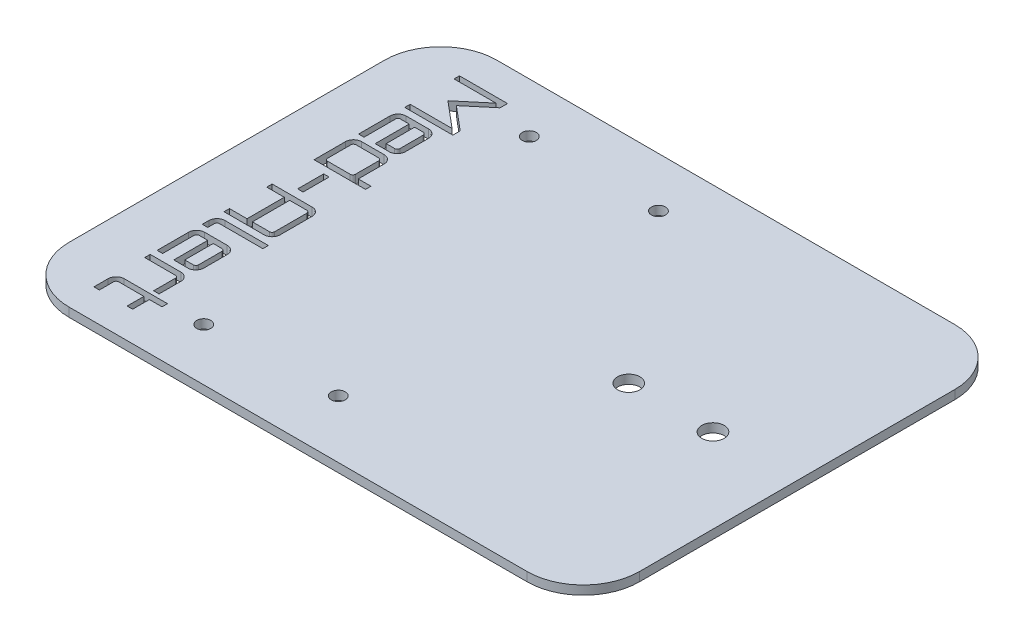
from build123d import *

# Parameters (mm, degrees)
SKETCH1_W           = 101.6
SKETCH1_H           = 76.2
BOSS_EXTRUDE1_DEPTH = 1.5875
SKETCH2_R           = 2
CUT_EXTRUDE1_DEPTH  = 64.51984065
FILLET1_R           = 10
SKETCH4_R           = 1.25
CUT_EXTRUDE2_DEPTH  = 64.51984065
SKETCH5_W           = 0.973447217
SKETCH5_H           = 4.636773317
CUT_EXTRUDE3_DEPTH  = 1.5875


with BuildPart() as part:
    # Sketch1 → Boss-Extrude1 (new body)
    with BuildSketch(Plane(origin=(0, 0, 0), x_dir=(1, 0, 0), z_dir=(0, 1, 0))):
        Rectangle(SKETCH1_W, SKETCH1_H)
    extrude(amount=BOSS_EXTRUDE1_DEPTH)

    # Sketch2 → Cut-Extrude1 (cut, through all)
    with BuildSketch(Plane(origin=(0, 1.5875, 0), x_dir=(1, 0, 0), z_dir=(0, 1, 0))):
        with Locations((35.8, 0)):
            Circle(SKETCH2_R)
        with Locations((20.8, 0)):
            Circle(SKETCH2_R)
    extrude(amount=-CUT_EXTRUDE1_DEPTH, mode=Mode.SUBTRACT)

    # Fillet1
    fillet1_edges = [part.edges().sort_by_distance(p)[0] for p in [
        (-50.8, 0.79375, -38.1),
        (-50.8, 0.79375, 38.1),
        (50.8, 0.79375, 38.1),
        (50.8, 0.79375, -38.1),
    ]]
    fillet(fillet1_edges, radius=FILLET1_R)

    # Sketch4 → Cut-Extrude2 (cut, through all)
    with BuildSketch(Plane(origin=(0, 1.5875, 0), x_dir=(1, 0, 0), z_dir=(0, 1, 0))):
        with Locations((-3.134370543, 29.218470634)):
            Circle(SKETCH4_R)
        with Locations((-3.134370543, -27.818050268)):
            Circle(SKETCH4_R)
        with Locations((-26.134370543, 29.218470634)):
            Circle(SKETCH4_R)
        with Locations((-26.134370543, -28.781529366)):
            Circle(SKETCH4_R)
    extrude(amount=-CUT_EXTRUDE2_DEPTH, mode=Mode.SUBTRACT)

    # Sketch5 → Cut-Extrude3 (cut)
    # profile 1 of 9: a face of its own
    with BuildSketch(Plane(origin=(0, 1.5875, 0), x_dir=(1, 0, 0), z_dir=(0, 1, 0))):
        Polygon((-41.714230592, 32.355940808), (-33.154430592, 32.355940808), (-33.154430592, 31.036799437), (-37.387034128, 27.481825236), (-33.154430592, 23.926851035), (-33.154430592, 22.607709664), (-41.714230592, 22.607709664), (-41.714230592, 23.570837653), (-34.248268808, 23.570837653), (-38.897081225, 27.481825236), (-34.248268808, 31.392812819), (-41.714230592, 31.392812819), align=None)
    # profile 2 of 9: a face of its own
    with BuildSketch(Plane(origin=(0, 1.5875, 0), x_dir=(1, 0, 0), z_dir=(0, 1, 0))):
        with BuildLine():
            add(Edge.make_bspline(
                [(-41.714230592, 19.969426924), (-41.712202655, 20.03385511), (-41.708200637, 20.161000417), (-41.667763496, 20.34624286), (-41.608496053, 20.524098308), (-41.52139129, 20.690482564), (-41.414767915, 20.844435426), (-41.292564206, 20.985579979), (-41.151417443, 21.107739613), (-40.997518132, 21.214543913), (-40.830272787, 21.30130826), (-40.653091122, 21.362959028), (-40.467195446, 21.40071205), (-40.340805862, 21.405036419), (-40.276418095, 21.407239421)],
                knots=[0, 0, 0, 0, 1.027217016, 2.02715352, 3.014270877, 4.013201324, 5.0135986, 5.999569355, 6.985540111, 7.985937386, 8.984867834, 9.983630507, 10.972782984, 12, 12, 12, 12], degree=3))
            Line((-40.276418095, 21.407239421), (-36.257078613, 21.407239421))
            add(Edge.make_bspline(
                [(-36.257078613, 21.407239421), (-36.192706319, 21.404969561), (-36.065784313, 21.400494108), (-35.879657952, 21.363562077), (-35.702807278, 21.300859029), (-35.535960075, 21.214597926), (-35.382087657, 21.107724252), (-35.240917391, 20.985588146), (-35.118781285, 20.844417879), (-35.011907611, 20.690545462), (-34.925646508, 20.523698259), (-34.86294346, 20.346847585), (-34.826011429, 20.160721224), (-34.821535976, 20.033799218), (-34.819266116, 19.969426924)],
                knots=[0, 0, 0, 0, 1.027084364, 2.025088736, 3.015087032, 4.013888481, 5.014156569, 6, 6.985843431, 7.986111519, 8.984912968, 9.974911264, 10.972915636, 12, 12, 12, 12], degree=3))
            Line((-34.819266116, 19.969426924), (-34.819266116, 15.833136186))
            add(Edge.make_bspline(
                [(-34.819266116, 15.833136186), (-34.821521309, 15.767049633), (-34.82594932, 15.637290448), (-34.862649634, 15.447656636), (-34.925705942, 15.268625343), (-35.011438059, 15.100319889), (-35.118745743, 14.946031506), (-35.241478514, 14.805018411), (-35.381455096, 14.680898566), (-35.536104242, 14.57449672), (-35.702385771, 14.487274781), (-35.880268447, 14.428038396), (-36.065503623, 14.387592965), (-36.192649924, 14.383592081), (-36.257078613, 14.381564718)],
                knots=[0, 0, 0, 0, 1.048634584, 2.058966034, 3.052054572, 4.053408781, 5.048122636, 6.02849193, 7.014884473, 8.009598329, 9.002853689, 9.984363071, 10.978618772, 12, 12, 12, 12], degree=3))
            Line((-36.257078613, 14.381564718), (-38.754331898, 14.381564718))
            Line((-38.754331898, 14.381564718), (-38.754331898, 20.433792204))
            Line((-38.754331898, 20.433792204), (-40.276418095, 20.433792204))
            add(Edge.make_bspline(
                [(-40.276418095, 20.433792204), (-40.307010937, 20.432251722), (-40.367052556, 20.429228365), (-40.453565175, 20.40168996), (-40.533952598, 20.358351206), (-40.604277118, 20.298022348), (-40.666133623, 20.228932046), (-40.706521439, 20.147749524), (-40.734815441, 20.061305712), (-40.737621004, 20.000625891), (-40.739063504, 19.969426924)],
                knots=[0, 0, 0, 0, 1.007354179, 1.977036842, 2.967724579, 4.002259672, 5.022329906, 6.004122603, 6.973805265, 8, 8, 8, 8], degree=3))
            Line((-40.739063504, 19.969426924), (-40.739063504, 14.381564718))
            Line((-40.739063504, 14.381564718), (-41.714230592, 14.381564718))
            Line((-41.714230592, 14.381564718), (-41.714230592, 19.969426924))
        make_face()
        with BuildLine():
            Line((-37.77916481, 20.433792204), (-37.77916481, 15.368770906))
            Line((-37.77916481, 15.368770906), (-36.257078613, 15.368770906))
            add(Edge.make_bspline(
                [(-36.257078613, 15.368770906), (-36.226460685, 15.370265567), (-36.166369832, 15.373198995), (-36.080476665, 15.4013127), (-35.999293132, 15.441700873), (-35.930203168, 15.503557226), (-35.86987401, 15.573881985), (-35.826536074, 15.654268642), (-35.798819889, 15.741333289), (-35.795922776, 15.80196299), (-35.794433204, 15.833136186)],
                knots=[0, 0, 0, 0, 1.007354179, 1.977036842, 2.958829539, 3.978899773, 5.013434866, 6.004122603, 6.973805265, 8, 8, 8, 8], degree=3))
            Line((-35.794433204, 15.833136186), (-35.794433204, 19.969426924))
            add(Edge.make_bspline(
                [(-35.794433204, 19.969426924), (-35.795915847, 20.000605439), (-35.798799485, 20.061245484), (-35.826613164, 20.148235294), (-35.869364321, 20.228523442), (-35.93074951, 20.297475989), (-35.999701779, 20.358860916), (-36.079990749, 20.401612818), (-36.166428813, 20.429248347), (-36.226480594, 20.432258466), (-36.257078613, 20.433792204)],
                knots=[0, 0, 0, 0, 1.026909697, 1.99726795, 2.988645912, 4.009426841, 5.03020777, 6.021585732, 6.991943984, 8, 8, 8, 8], degree=3))
            Line((-36.257078613, 20.433792204), (-37.77916481, 20.433792204))
        make_face(mode=Mode.SUBTRACT)
    # profile 3 of 9: a face of its own
    with BuildSketch(Plane(origin=(0, 1.5875, 0), x_dir=(1, 0, 0), z_dir=(0, 1, 0))):
        with BuildLine():
            add(Edge.make_bspline(
                [(-41.714230592, 12.035660117), (-41.712221556, 12.101802574), (-41.708273492, 12.231782622), (-41.668055971, 12.420543059), (-41.608429869, 12.60055972), (-41.521887325, 12.768442755), (-41.414713989, 12.92267934), (-41.29257856, 13.063859825), (-41.151413534, 13.186009848), (-40.997519184, 13.292816759), (-40.830272505, 13.379580404), (-40.653091196, 13.44123136), (-40.467195426, 13.478984332), (-40.340805856, 13.483308708), (-40.276418095, 13.485511714)],
                knots=[0, 0, 0, 0, 1.049191641, 2.061822075, 3.052470829, 4.054356978, 5.049599247, 6.030489334, 7.011379422, 8.00662169, 9.000404689, 9.994020778, 10.978076193, 12, 12, 12, 12], degree=3))
            Line((-40.276418095, 13.485511714), (-36.257078613, 13.485511714))
            add(Edge.make_bspline(
                [(-36.257078613, 13.485511714), (-36.192706325, 13.48324185), (-36.065784332, 13.47876639), (-35.879657879, 13.441834408), (-35.702807552, 13.379131177), (-35.535959038, 13.292870764), (-35.382091508, 13.185994517), (-35.240903252, 13.063867881), (-35.118834402, 12.922662211), (-35.011413975, 12.768504282), (-34.925712347, 12.600163549), (-34.862647901, 12.421141672), (-34.825949776, 12.231505328), (-34.821521462, 12.101746492), (-34.819266116, 12.035660117)],
                knots=[0, 0, 0, 0, 1.021792034, 2.014653917, 2.999550978, 3.993205832, 4.988319767, 5.969083372, 6.949846977, 7.944960913, 8.946717872, 9.940205837, 10.950943649, 12, 12, 12, 12], degree=3))
            Line((-34.819266116, 12.035660117), (-34.819266116, 7.435004099))
            Line((-34.819266116, 7.435004099), (-32.561074956, 7.435004099))
            Line((-32.561074956, 7.435004099), (-32.561074956, 6.45983701))
            Line((-32.561074956, 6.45983701), (-41.714230592, 6.45983701))
            Line((-41.714230592, 6.45983701), (-41.714230592, 12.035660117))
        make_face()
        with BuildLine():
            Line((-40.739063504, 12.035660117), (-40.739063504, 7.897649508))
            add(Edge.make_bspline(
                [(-40.739063504, 7.897649508), (-40.737562032, 7.86703679), (-40.73461524, 7.806956163), (-40.706599302, 7.720988192), (-40.665634815, 7.639699996), (-40.604831642, 7.569235961), (-40.534367606, 7.508432787), (-40.45307941, 7.4674683), (-40.36711144, 7.439452363), (-40.307030812, 7.43650557), (-40.276418095, 7.435004099)],
                knots=[0, 0, 0, 0, 1.009027997, 1.980321883, 2.963745925, 4, 5.036254075, 6.019678117, 6.990972003, 8, 8, 8, 8], degree=3))
            Line((-40.276418095, 7.435004099), (-36.257078613, 7.435004099))
            add(Edge.make_bspline(
                [(-36.257078613, 7.435004099), (-36.226460685, 7.43649876), (-36.166369833, 7.439432187), (-36.080476661, 7.467545896), (-35.999293144, 7.507934054), (-35.930203121, 7.569790463), (-35.869874187, 7.64011501), (-35.826535452, 7.720502426), (-35.798997042, 7.807015047), (-35.795973686, 7.867056666), (-35.794433204, 7.897649508)],
                knots=[0, 0, 0, 0, 1.009732169, 1.981703892, 2.965814237, 3.988292478, 5.025269725, 6.018296108, 6.990267831, 8, 8, 8, 8], degree=3))
            Line((-35.794433204, 7.897649508), (-35.794433204, 12.035660117))
            add(Edge.make_bspline(
                [(-35.794433204, 12.035660117), (-35.795966942, 12.066258136), (-35.79897706, 12.126309916), (-35.826612593, 12.212747984), (-35.86936448, 12.293036939), (-35.930749467, 12.361989262), (-35.99970179, 12.423374249), (-36.079990746, 12.466126136), (-36.166428814, 12.493761669), (-36.226480594, 12.496771788), (-36.257078613, 12.498305525)],
                knots=[0, 0, 0, 0, 1.010437324, 1.983087831, 2.976807703, 4, 5.023192297, 6.016912169, 6.989562676, 8, 8, 8, 8], degree=3))
            Line((-36.257078613, 12.498305525), (-40.276418095, 12.498305525))
            add(Edge.make_bspline(
                [(-40.276418095, 12.498305525), (-40.307010937, 12.496765043), (-40.367052555, 12.493741687), (-40.453565176, 12.466203277), (-40.533952592, 12.422864543), (-40.604277139, 12.362535609), (-40.666133548, 12.293445586), (-40.706521706, 12.212262068), (-40.734635416, 12.126368897), (-40.737568843, 12.066278044), (-40.739063504, 12.035660117)],
                knots=[0, 0, 0, 0, 1.009732169, 1.981703892, 2.974730275, 4.011707522, 5.034185763, 6.018296108, 6.990267831, 8, 8, 8, 8], degree=3))
        make_face(mode=Mode.SUBTRACT)
    # profile 4 of 9: a face of its own
    with BuildSketch(Plane(origin=(0, 1.5875, 0), x_dir=(1, 0, 0), z_dir=(0, 1, 0))):
        with Locations((-38.195373691, 2.813709624)):
            Rectangle(SKETCH5_W, SKETCH5_H)
    # profile 5 of 9: a face of its own
    with BuildSketch(Plane(origin=(0, 1.5875, 0), x_dir=(1, 0, 0), z_dir=(0, 1, 0))):
        with BuildLine():
            Line((-41.714230592, -1.019883745), (-34.581923861, -1.019883745))
            add(Edge.make_bspline(
                [(-34.581923861, -1.019883745), (-34.51752073, -1.022062661), (-34.390537922, -1.026358801), (-34.205222364, -1.064527671), (-34.02728682, -1.12204368), (-33.861510954, -1.207773361), (-33.706472823, -1.310520478), (-33.56610203, -1.430903159), (-33.44456763, -1.570361941), (-33.34239086, -1.725299973), (-33.2565718, -1.891005328), (-33.199079563, -2.068959626), (-33.160904336, -2.254270169), (-33.156609066, -2.381253663), (-33.154430592, -2.445657143)],
                knots=[0, 0, 0, 0, 1.032216714, 2.035208122, 3.024182869, 4.023794347, 5.018739673, 6.003470517, 6.981260327, 7.976205653, 8.975817131, 9.964791878, 10.967783286, 12, 12, 12, 12], degree=3))
            Line((-33.154430592, -2.445657143), (-33.154430592, -8.152190476))
            add(Edge.make_bspline(
                [(-33.154430592, -8.152190476), (-33.156542973, -8.216608949), (-33.160689459, -8.343058806), (-33.199666595, -8.52815158), (-33.256124602, -8.706422535), (-33.342465046, -8.872505218), (-33.44446762, -9.027589131), (-33.566673078, -9.166862181), (-33.705852561, -9.289188419), (-33.861593547, -9.391699752), (-34.027264928, -9.477548826), (-34.205228262, -9.53503308), (-34.390536388, -9.573210442), (-34.517520214, -9.577505419), (-34.581923861, -9.579683745)],
                knots=[0, 0, 0, 0, 1.03172279, 2.025214077, 3.022441902, 4.021575058, 5.016044295, 5.993366225, 6.983661833, 7.97813107, 8.977264226, 9.965765741, 10.96827721, 12, 12, 12, 12], degree=3))
            Line((-34.581923861, -9.579683745), (-41.714230592, -9.579683745))
            Line((-41.714230592, -9.579683745), (-41.714230592, -8.616555756))
            Line((-41.714230592, -8.616555756), (-38.587504372, -8.616555756))
            Line((-38.587504372, -8.616555756), (-38.587504372, -1.983011734))
            Line((-38.587504372, -1.983011734), (-41.714230592, -1.983011734))
            Line((-41.714230592, -1.983011734), (-41.714230592, -1.019883745))
        make_face()
        with BuildLine():
            Line((-37.624376383, -1.983011734), (-37.624376383, -8.616555756))
            Line((-37.624376383, -8.616555756), (-34.581923861, -8.616555756))
            add(Edge.make_bspline(
                [(-34.581923861, -8.616555756), (-34.550724894, -8.615113256), (-34.490045072, -8.612307693), (-34.403601265, -8.584013695), (-34.322418726, -8.543625865), (-34.253328485, -8.481769416), (-34.192999403, -8.411444683), (-34.149661447, -8.331058019), (-34.121945267, -8.243993374), (-34.119048153, -8.183363673), (-34.117558581, -8.152190476)],
                knots=[0, 0, 0, 0, 1.023783653, 1.991188011, 2.970673951, 3.988347493, 5.020451908, 6.008811989, 6.976216347, 8, 8, 8, 8], degree=3))
            Line((-34.117558581, -8.152190476), (-34.117558581, -2.445657143))
            add(Edge.make_bspline(
                [(-34.117558581, -2.445657143), (-34.119092319, -2.415059123), (-34.122102438, -2.355007343), (-34.149737967, -2.268569279), (-34.19248987, -2.188280309), (-34.253874796, -2.11932804), (-34.322827343, -2.057942851), (-34.403115491, -2.015191693), (-34.490105301, -1.987378014), (-34.550745346, -1.984494377), (-34.581923861, -1.983011734)],
                knots=[0, 0, 0, 0, 1.008056016, 1.978414268, 2.96979223, 3.990573159, 5.011354088, 6.00273205, 6.973090303, 8, 8, 8, 8], degree=3))
            Line((-34.581923861, -1.983011734), (-37.624376383, -1.983011734))
        make_face(mode=Mode.SUBTRACT)
    # profile 6 of 9: a face of its own
    with BuildSketch(Plane(origin=(0, 1.5875, 0), x_dir=(1, 0, 0), z_dir=(0, 1, 0))):
        with BuildLine():
            add(Edge.make_bspline(
                [(-41.714230592, -12.293640828), (-41.712202655, -12.229212641), (-41.708200638, -12.10206733), (-41.667763493, -11.916824907), (-41.608496065, -11.738969385), (-41.521391245, -11.572585411), (-41.414768084, -11.418631496), (-41.292563588, -11.277490819), (-41.151419768, -11.155316695), (-40.997509321, -11.048567217), (-40.830305598, -10.961597953), (-40.652861155, -10.900671947), (-40.467427317, -10.860060752), (-40.340845602, -10.856116171), (-40.276418095, -10.854108459)],
                knots=[0, 0, 0, 0, 1.02706128, 2.026846186, 3.013813887, 4.012592888, 5.012838495, 5.998659769, 6.984481042, 7.984726649, 8.98350565, 9.982116902, 10.97293872, 12, 12, 12, 12], degree=3))
            Line((-40.276418095, -10.854108459), (-32.561074956, -10.854108459))
            Line((-32.561074956, -10.854108459), (-32.561074956, -11.829275548))
            Line((-32.561074956, -11.829275548), (-40.276418095, -11.829275548))
            add(Edge.make_bspline(
                [(-40.276418095, -11.829275548), (-40.307010937, -11.83081603), (-40.367052556, -11.833839387), (-40.453565175, -11.861377792), (-40.533952598, -11.904716546), (-40.604277118, -11.965045404), (-40.666133623, -12.034135705), (-40.706521439, -12.115318228), (-40.734815441, -12.20176204), (-40.737621004, -12.262441861), (-40.739063504, -12.293640828)],
                knots=[0, 0, 0, 0, 1.007354179, 1.977036842, 2.967724579, 4.002259672, 5.022329906, 6.004122603, 6.973805265, 8, 8, 8, 8], degree=3))
            Line((-40.739063504, -12.293640828), (-40.739063504, -13.457993771))
            Line((-40.739063504, -13.457993771), (-41.714230592, -13.457993771))
            Line((-41.714230592, -13.457993771), (-41.714230592, -12.293640828))
        make_face()
    # profile 7 of 9: a face of its own
    with BuildSketch(Plane(origin=(0, 1.5875, 0), x_dir=(1, 0, 0), z_dir=(0, 1, 0))):
        with BuildLine():
            add(Edge.make_bspline(
                [(-41.714230592, -15.913970143), (-41.712202655, -15.849541957), (-41.708200637, -15.722396649), (-41.667763496, -15.537154206), (-41.608496053, -15.359298759), (-41.52139129, -15.192914503), (-41.414767915, -15.03896164), (-41.292564206, -14.897817087), (-41.151417443, -14.775657454), (-40.997518132, -14.668853153), (-40.830272787, -14.582088807), (-40.653091122, -14.520438038), (-40.467195446, -14.482685017), (-40.340805862, -14.478360647), (-40.276418095, -14.476157645)],
                knots=[0, 0, 0, 0, 1.027217016, 2.02715352, 3.014270877, 4.013201324, 5.0135986, 5.999569355, 6.985540111, 7.985937386, 8.984867834, 9.983630507, 10.972782984, 12, 12, 12, 12], degree=3))
            Line((-40.276418095, -14.476157645), (-36.257078613, -14.476157645))
            add(Edge.make_bspline(
                [(-36.257078613, -14.476157645), (-36.192706319, -14.478427505), (-36.065784313, -14.482902959), (-35.879657952, -14.519834989), (-35.702807278, -14.582538038), (-35.535960075, -14.668799141), (-35.382087657, -14.775672815), (-35.240917391, -14.89780892), (-35.118781285, -15.038979187), (-35.011907611, -15.192851605), (-34.925646508, -15.359698807), (-34.86294346, -15.536549482), (-34.826011429, -15.722675842), (-34.821535976, -15.849597848), (-34.819266116, -15.913970143)],
                knots=[0, 0, 0, 0, 1.027084364, 2.025088736, 3.015087032, 4.013888481, 5.014156569, 6, 6.985843431, 7.986111519, 8.984912968, 9.974911264, 10.972915636, 12, 12, 12, 12], degree=3))
            Line((-34.819266116, -15.913970143), (-34.819266116, -20.05026088))
            add(Edge.make_bspline(
                [(-34.819266116, -20.05026088), (-34.821521309, -20.116347434), (-34.82594932, -20.246106619), (-34.862649634, -20.43574043), (-34.925705942, -20.614771724), (-35.011438059, -20.783077178), (-35.118745743, -20.937365561), (-35.241478514, -21.078378656), (-35.381455096, -21.202498501), (-35.536104242, -21.308900347), (-35.702385771, -21.396122286), (-35.880268447, -21.45535867), (-36.065503623, -21.495804101), (-36.192649924, -21.499804986), (-36.257078613, -21.501832349)],
                knots=[0, 0, 0, 0, 1.048634584, 2.058966034, 3.052054572, 4.053408781, 5.048122636, 6.02849193, 7.014884473, 8.009598329, 9.002853689, 9.984363071, 10.978618772, 12, 12, 12, 12], degree=3))
            Line((-36.257078613, -21.501832349), (-38.754331898, -21.501832349))
            Line((-38.754331898, -21.501832349), (-38.754331898, -15.449604862))
            Line((-38.754331898, -15.449604862), (-40.276418095, -15.449604862))
            add(Edge.make_bspline(
                [(-40.276418095, -15.449604862), (-40.307010937, -15.451145345), (-40.367052556, -15.454168702), (-40.453565175, -15.481707107), (-40.533952598, -15.525045861), (-40.604277118, -15.585374719), (-40.666133623, -15.65446502), (-40.706521439, -15.735647543), (-40.734815441, -15.822091355), (-40.737621004, -15.882771176), (-40.739063504, -15.913970143)],
                knots=[0, 0, 0, 0, 1.007354179, 1.977036842, 2.967724579, 4.002259672, 5.022329906, 6.004122603, 6.973805265, 8, 8, 8, 8], degree=3))
            Line((-40.739063504, -15.913970143), (-40.739063504, -21.501832349))
            Line((-40.739063504, -21.501832349), (-41.714230592, -21.501832349))
            Line((-41.714230592, -21.501832349), (-41.714230592, -15.913970143))
        make_face()
        with BuildLine():
            Line((-37.77916481, -15.449604862), (-37.77916481, -20.51462616))
            Line((-37.77916481, -20.51462616), (-36.257078613, -20.51462616))
            add(Edge.make_bspline(
                [(-36.257078613, -20.51462616), (-36.226460685, -20.513131499), (-36.166369832, -20.510198072), (-36.080476665, -20.482084366), (-35.999293132, -20.441696194), (-35.930203168, -20.379839841), (-35.86987401, -20.309515081), (-35.826536074, -20.229128424), (-35.798819889, -20.142063777), (-35.795922776, -20.081434077), (-35.794433204, -20.05026088)],
                knots=[0, 0, 0, 0, 1.007354179, 1.977036842, 2.958829539, 3.978899773, 5.013434866, 6.004122603, 6.973805265, 8, 8, 8, 8], degree=3))
            Line((-35.794433204, -20.05026088), (-35.794433204, -15.913970143))
            add(Edge.make_bspline(
                [(-35.794433204, -15.913970143), (-35.795915847, -15.882791627), (-35.798799485, -15.822151583), (-35.826613164, -15.735161773), (-35.869364321, -15.654873625), (-35.93074951, -15.585921077), (-35.999701779, -15.524536151), (-36.079990749, -15.481784248), (-36.166428813, -15.454148719), (-36.226480594, -15.4511386), (-36.257078613, -15.449604862)],
                knots=[0, 0, 0, 0, 1.026909697, 1.99726795, 2.988645912, 4.009426841, 5.03020777, 6.021585732, 6.991943984, 8, 8, 8, 8], degree=3))
            Line((-36.257078613, -15.449604862), (-37.77916481, -15.449604862))
        make_face(mode=Mode.SUBTRACT)
    # profile 8 of 9: a face of its own
    with BuildSketch(Plane(origin=(0, 1.5875, 0), x_dir=(1, 0, 0), z_dir=(0, 1, 0))):
        with BuildLine():
            Line((-41.714230592, -22.741859634), (-36.257078613, -22.741859634))
            add(Edge.make_bspline(
                [(-36.257078613, -22.741859634), (-36.192667344, -22.743936139), (-36.06555542, -22.748034001), (-35.879883583, -22.787809583), (-35.702775245, -22.849800753), (-35.535968708, -22.936263894), (-35.38208538, -23.04308336), (-35.240917997, -23.165233793), (-35.11878112, -23.306400227), (-35.011907656, -23.460273686), (-34.925646497, -23.627120609), (-34.862943463, -23.803971358), (-34.826011428, -23.990097699), (-34.821535975, -24.117019708), (-34.819266116, -24.181392003)],
                knots=[0, 0, 0, 0, 1.026930068, 2.026587245, 3.016436816, 4.015088217, 5.015206038, 6.000901367, 6.986596697, 7.986714517, 8.985365918, 9.975215489, 10.973069932, 12, 12, 12, 12], degree=3))
            Line((-34.819266116, -24.181392003), (-34.819266116, -28.056262287))
            Line((-34.819266116, -28.056262287), (-35.794433204, -28.056262287))
            Line((-35.794433204, -28.056262287), (-35.794433204, -24.181392003))
            add(Edge.make_bspline(
                [(-35.794433204, -24.181392003), (-35.795915847, -24.150213488), (-35.798799485, -24.089573443), (-35.826613164, -24.002583633), (-35.869364321, -23.922295485), (-35.93074951, -23.853342938), (-35.999701779, -23.791958012), (-36.079990749, -23.749206109), (-36.166428813, -23.72157058), (-36.226480594, -23.718560461), (-36.257078613, -23.717026723)],
                knots=[0, 0, 0, 0, 1.026909697, 1.99726795, 2.988645912, 4.009426841, 5.03020777, 6.021585732, 6.991943984, 8, 8, 8, 8], degree=3))
            Line((-36.257078613, -23.717026723), (-41.714230592, -23.717026723))
            Line((-41.714230592, -23.717026723), (-41.714230592, -22.741859634))
        make_face()
    # profile 9 of 9: a face of its own
    with BuildSketch(Plane(origin=(0, 1.5875, 0), x_dir=(1, 0, 0), z_dir=(0, 1, 0))):
        with BuildLine():
            add(Edge.make_bspline(
                [(-41.714230592, -30.247378461), (-41.7122222, -30.181235394), (-41.708275402, -30.05125415), (-41.668048707, -29.862502385), (-41.608456607, -29.682453584), (-41.521786444, -29.514691178), (-41.415330022, -29.360362986), (-41.291807291, -29.221096501), (-41.15253295, -29.098280902), (-40.996722321, -28.995893404), (-40.83065297, -28.909536658), (-40.652378452, -28.853083007), (-40.467286619, -28.81410472), (-40.340836633, -28.809958393), (-40.276418095, -28.807846092)],
                knots=[0, 0, 0, 0, 1.051561752, 2.066479706, 3.059366323, 4.063515721, 5.06100623, 6.037267067, 7.020372973, 8.007622208, 8.9995015, 9.989489295, 10.975767679, 12, 12, 12, 12], degree=3))
            Line((-40.276418095, -28.807846092), (-32.561074956, -28.807846092))
            Line((-32.561074956, -28.807846092), (-32.561074956, -29.783013181))
            Line((-32.561074956, -29.783013181), (-34.819266116, -29.783013181))
            Line((-34.819266116, -29.783013181), (-34.819266116, -32.766990074))
            Line((-34.819266116, -32.766990074), (-35.794433204, -32.766990074))
            Line((-35.794433204, -32.766990074), (-35.794433204, -29.783013181))
            Line((-35.794433204, -29.783013181), (-40.276418095, -29.783013181))
            add(Edge.make_bspline(
                [(-40.276418095, -29.783013181), (-40.307010937, -29.784553663), (-40.367052556, -29.78757702), (-40.453565175, -29.815115425), (-40.533952598, -29.858454179), (-40.604277118, -29.918783037), (-40.666133623, -29.987873338), (-40.706521439, -30.069055861), (-40.734815441, -30.155499673), (-40.737621004, -30.216179494), (-40.739063504, -30.247378461)],
                knots=[0, 0, 0, 0, 1.007354179, 1.977036842, 2.967724579, 4.002259672, 5.022329906, 6.004122603, 6.973805265, 8, 8, 8, 8], degree=3))
            Line((-40.739063504, -30.247378461), (-40.739063504, -32.766990074))
            Line((-40.739063504, -32.766990074), (-41.714230592, -32.766990074))
            Line((-41.714230592, -32.766990074), (-41.714230592, -30.247378461))
        make_face()
    extrude(amount=-CUT_EXTRUDE3_DEPTH, mode=Mode.SUBTRACT)


with BuildPart() as cut_extrude3_piece_1:
    # of the separate pieces the step leaves, piece 1, a body of its own (cut_extrude3_pieces)
    add(part.part.solids().sort_by_distance((40.8, 0, 38.1))[0])


with BuildPart() as cut_extrude3_piece_2:
    # of the separate pieces the step leaves, piece 2, a body of its own (cut_extrude3_pieces)
    add(part.part.solids().sort_by_distance((-40.739063504, 0, -12.035660117))[0])


with BuildPart() as cut_extrude3_piece_3:
    # of the separate pieces the step leaves, piece 3, a body of its own (cut_extrude3_pieces)
    add(part.part.solids().sort_by_distance((-37.624376383, 0, 1.983011734))[0])


with BuildPart() as cut_extrude3_piece_4:
    # of the separate pieces the step leaves, piece 4, a body of its own (cut_extrude3_pieces)
    add(part.part.solids().sort_by_distance((-37.77916481, 0, 15.449604862))[0])


with BuildPart() as cut_extrude3_piece_5:
    # of the separate pieces the step leaves, piece 5, a body of its own (cut_extrude3_pieces)
    add(part.part.solids().sort_by_distance((-37.77916481, 0, -20.433792204))[0])


solid = Compound([cut_extrude3_piece_1.part, cut_extrude3_piece_2.part, cut_extrude3_piece_3.part, cut_extrude3_piece_4.part, cut_extrude3_piece_5.part])
